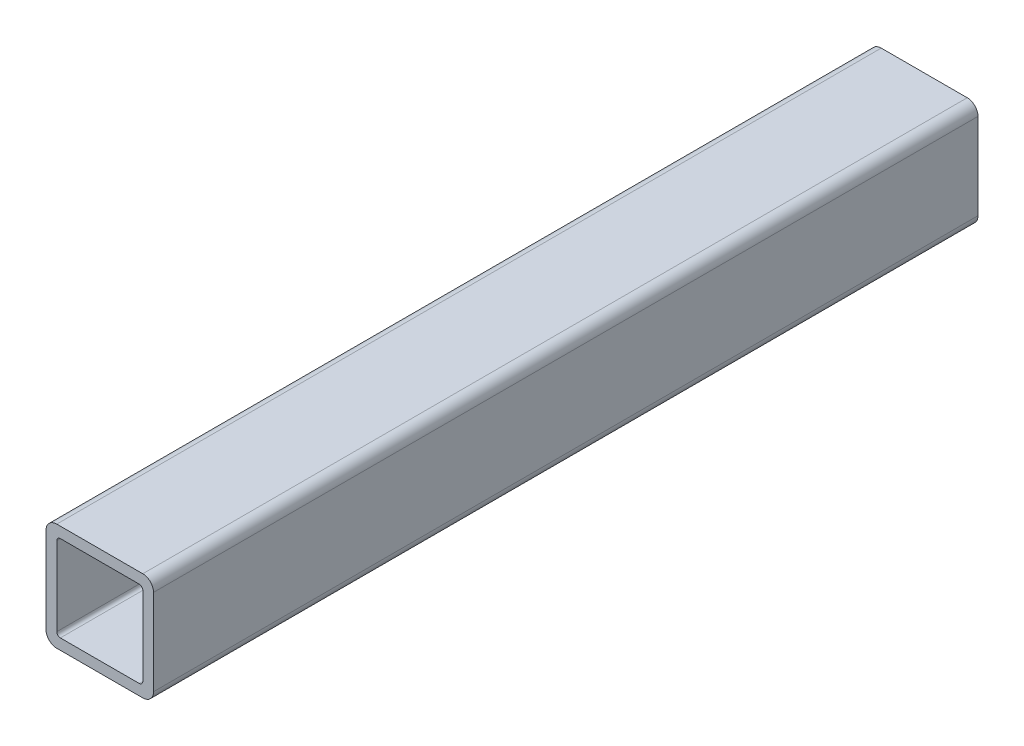
from build123d import *

# Parameters (mm, degrees)
DODANIE_WYCI_GNI_CIE1_DEPTH = 230


with BuildPart() as part:
    # Szkic1 → Dodanie-wyciągnięcie1 (new body)
    with BuildSketch(Plane.XY):
        with BuildLine():
            Line((-12, -15), (12, -15))
            ThreePointArc((12, -15), (14.121320344, -14.121320344), (15, -12))
            Line((15, -12), (15, 12))
            ThreePointArc((15, 12), (14.121320344, 14.121320344), (12, 15))
            Line((12, 15), (-12, 15))
            ThreePointArc((-12, 15), (-14.121320344, 14.121320344), (-15, 12))
            Line((-15, 12), (-15, -12))
            ThreePointArc((-15, -12), (-14.121320344, -14.121320344), (-12, -15))
        make_face()
        with BuildLine():
            Line((-11, -12), (11, -12))
            ThreePointArc((11, -12), (11.707106781, -11.707106781), (12, -11))
            Line((12, -11), (12, 11))
            ThreePointArc((12, 11), (11.707106781, 11.707106781), (11, 12))
            Line((11, 12), (-11, 12))
            ThreePointArc((-11, 12), (-11.707106781, 11.707106781), (-12, 11))
            Line((-12, 11), (-12, -11))
            ThreePointArc((-12, -11), (-11.707106781, -11.707106781), (-11, -12))
        make_face(mode=Mode.SUBTRACT)
    extrude(amount=DODANIE_WYCI_GNI_CIE1_DEPTH)


solid = part.part
